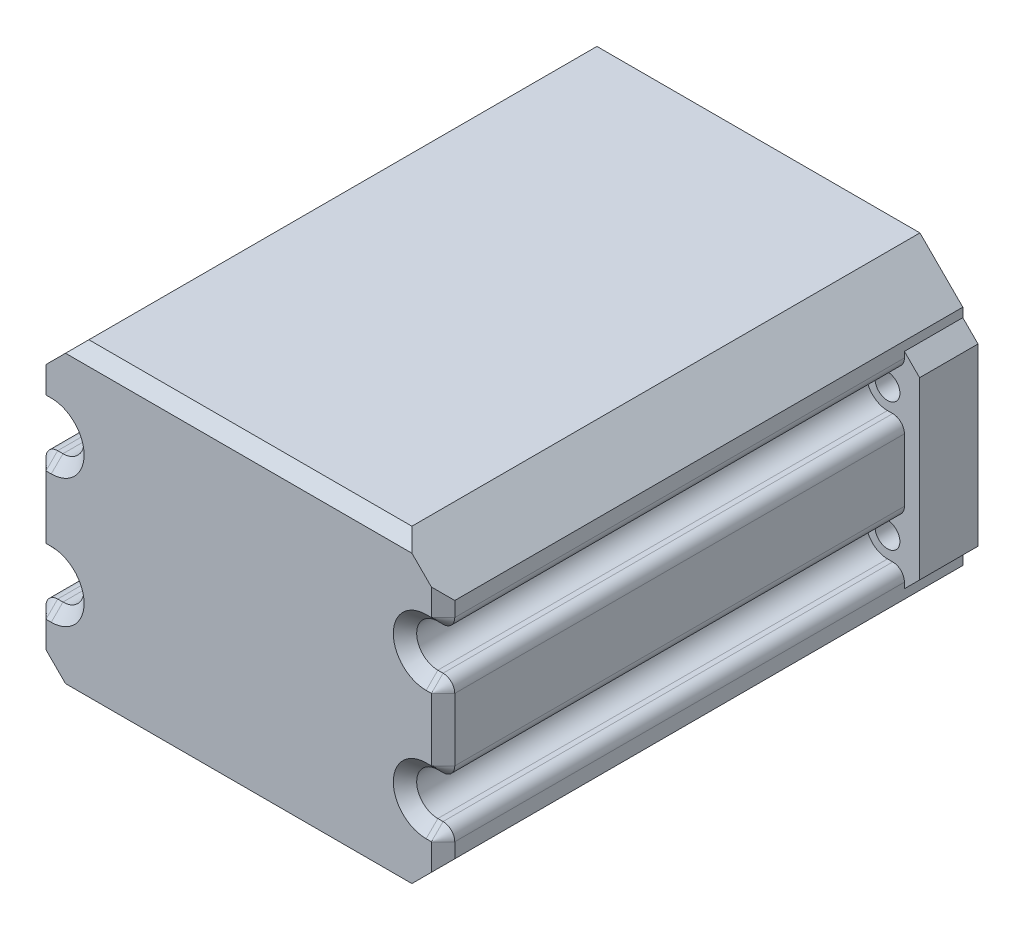
from build123d import *

# Parameters (mm, degrees)
BOSS_EXTRUDE1_DEPTH = 85
SKETCH1_3_R         = 2.125
BOSS_EXTRUDE2_DEPTH = 10
FILLET1_R           = 2
BOSS_EXTRUDE3_START = 4
BOSS_EXTRUDE3_DEPTH = 4
CHAMFER1_SIZE       = 2


with BuildPart() as part:
    # Sketch1 → Boss-Extrude1 (new body)
    with BuildSketch(Plane.XY):
        with BuildLine():
            Line((55.313708499, 53), (0, 53))
            Line((0, 53), (-7.343145751, 45.656854249))
            Line((-7.343145751, 45.656854249), (-7.343145751, 41.125))
            Line((-7.343145751, 41.125), (-4.443145751, 41.125))
            ThreePointArc((-4.443145751, 41.125), (-0.818145751, 37.5), (-4.443145751, 33.875))
            Line((-4.443145751, 33.875), (-7.343145751, 33.875))
            Line((-7.343145751, 33.875), (-7.343145751, 19.125))
            Line((-7.343145751, 19.125), (-4.443145751, 19.125))
            ThreePointArc((-4.443145751, 19.125), (-0.818145751, 15.5), (-4.443145751, 11.875))
            Line((-4.443145751, 11.875), (-7.343145751, 11.875))
            Line((-7.343145751, 11.875), (-7.343145751, 7.343145751))
            Line((-7.343145751, 7.343145751), (0, 0))
            Line((0, 0), (55.313708499, 0))
            Line((55.313708499, 0), (62.656854249, 7.343145751))
            Line((62.656854249, 7.343145751), (62.656854249, 11.875))
            Line((62.656854249, 11.875), (59.756854249, 11.875))
            ThreePointArc((59.756854249, 11.875), (56.131854249, 15.5), (59.756854249, 19.125))
            Line((59.756854249, 19.125), (62.656854249, 19.125))
            Line((62.656854249, 19.125), (62.656854249, 33.875))
            Line((62.656854249, 33.875), (59.756854249, 33.875))
            ThreePointArc((59.756854249, 33.875), (56.131854249, 37.5), (59.756854249, 41.125))
            Line((59.756854249, 41.125), (62.656854249, 41.125))
            Line((62.656854249, 41.125), (62.656854249, 45.656854249))
            Line((62.656854249, 45.656854249), (55.313708499, 53))
        make_face()
        with BuildLine():
            Line((53.656854249, 4), (1.656854249, 4))
            Line((1.656854249, 4), (-3.343145751, 9))
            Line((-3.343145751, 9), (-3.343145751, 9.601695159))
            ThreePointArc((-3.343145751, 9.601695159), (0.172046553, 11.665942097), (1.556854249, 15.5))
            Line((1.556854249, 15.5), (1.556854249, 37.5))
            ThreePointArc((1.556854249, 37.5), (0.172046553, 41.334057903), (-3.343145751, 43.398304841))
            Line((-3.343145751, 43.398304841), (-3.343145751, 44))
            Line((-3.343145751, 44), (1.656854249, 49))
            Line((1.656854249, 49), (53.656854249, 49))
            Line((53.656854249, 49), (58.656854249, 44))
            Line((58.656854249, 44), (58.656854249, 43.398304841))
            ThreePointArc((58.656854249, 43.398304841), (55.141661946, 41.334057903), (53.756854249, 37.5))
            Line((53.756854249, 37.5), (53.756854249, 15.5))
            ThreePointArc((53.756854249, 15.5), (55.141661946, 11.665942097), (58.656854249, 9.601695159))
            Line((58.656854249, 9.601695159), (58.656854249, 9))
            Line((58.656854249, 9), (53.656854249, 4))
        make_face(mode=Mode.SUBTRACT)
    extrude(amount=BOSS_EXTRUDE1_DEPTH)

    # Sketch1<3> → Boss-Extrude2 (add)
    # profile 1 of 2: a face of its own
    with BuildSketch(Plane.XY):
        with BuildLine():
            ThreePointArc((-4.443145751, 33.875), (-0.818145751, 37.5), (-4.443145751, 41.125))
            Line((-4.443145751, 41.125), (-7.343145751, 41.125))
            Line((-7.343145751, 41.125), (-7.343145751, 44.1))
            Line((-7.343145751, 44.1), (-9.943145751, 41.5))
            Line((-9.943145751, 41.5), (-9.943145751, 11.5))
            Line((-9.943145751, 11.5), (-7.343145751, 8.9))
            Line((-7.343145751, 8.9), (-7.343145751, 11.875))
            Line((-7.343145751, 11.875), (-4.443145751, 11.875))
            ThreePointArc((-4.443145751, 11.875), (-0.818145751, 15.5), (-4.443145751, 19.125))
            Line((-4.443145751, 19.125), (-7.343145751, 19.125))
            Line((-7.343145751, 19.125), (-7.343145751, 33.875))
            Line((-7.343145751, 33.875), (-4.443145751, 33.875))
        make_face()
        with Locations((-4.443145751, 15.5)):
            Circle(SKETCH1_3_R, mode=Mode.SUBTRACT)
        with Locations((-4.443145751, 37.5)):
            Circle(SKETCH1_3_R, mode=Mode.SUBTRACT)
    # profile 2 of 2: a face of its own
    with BuildSketch(Plane.XY):
        with BuildLine():
            Line((65.256854249, 41.5), (62.656854249, 44.1))
            Line((62.656854249, 44.1), (62.656854249, 41.125))
            Line((62.656854249, 41.125), (59.756854249, 41.125))
            ThreePointArc((59.756854249, 41.125), (56.131854249, 37.5), (59.756854249, 33.875))
            Line((59.756854249, 33.875), (62.656854249, 33.875))
            Line((62.656854249, 33.875), (62.656854249, 19.125))
            Line((62.656854249, 19.125), (59.756854249, 19.125))
            ThreePointArc((59.756854249, 19.125), (56.131854249, 15.5), (59.756854249, 11.875))
            Line((59.756854249, 11.875), (62.656854249, 11.875))
            Line((62.656854249, 11.875), (62.656854249, 8.9))
            Line((62.656854249, 8.9), (65.256854249, 11.5))
            Line((65.256854249, 11.5), (65.256854249, 41.5))
        make_face()
        with Locations((59.756854249, 37.5)):
            Circle(SKETCH1_3_R, mode=Mode.SUBTRACT)
        with Locations((59.756854249, 15.5)):
            Circle(SKETCH1_3_R, mode=Mode.SUBTRACT)
    extrude(amount=BOSS_EXTRUDE2_DEPTH)

    # Fillet1
    fillet1_edges = [part.edges().sort_by_distance(p)[0] for p in [
        (62.656854249, 41.125, 47.5),
        (62.656854249, 33.875, 47.5),
        (62.656854249, 19.125, 47.5),
        (62.656854249, 11.875, 47.5),
        (-7.343145751, 11.875, 47.5),
        (-7.343145751, 19.125, 47.5),
        (-7.343145751, 33.875, 47.5),
        (-7.343145751, 41.125, 47.5),
    ]]
    fillet(fillet1_edges, radius=FILLET1_R)

    # Sketch2 → Boss-Extrude3 (add)
    with BuildSketch(Plane.XY.offset(85).offset(BOSS_EXTRUDE3_START)):
        with BuildLine():
            Line((-7.343145751, 31.875), (-7.343145751, 21.125))
            ThreePointArc((-7.343145751, 21.125), (-6.757359313, 19.710786438), (-5.343145751, 19.125))
            Line((-5.343145751, 19.125), (-4.443145751, 19.125))
            ThreePointArc((-4.443145751, 19.125), (-0.818145751, 15.5), (-4.443145751, 11.875))
            Line((-4.443145751, 11.875), (-5.343145751, 11.875))
            ThreePointArc((-5.343145751, 11.875), (-6.757359313, 11.289213562), (-7.343145751, 9.875))
            Line((-7.343145751, 9.875), (-7.343145751, 7.343145751))
            Line((-7.343145751, 7.343145751), (0, 0))
            Line((0, 0), (55.313708499, 0))
            Line((55.313708499, 0), (62.656854249, 7.343145751))
            Line((62.656854249, 7.343145751), (62.656854249, 9.875))
            ThreePointArc((62.656854249, 9.875), (62.071067812, 11.289213562), (60.656854249, 11.875))
            Line((60.656854249, 11.875), (59.756854249, 11.875))
            ThreePointArc((59.756854249, 11.875), (56.131854249, 15.5), (59.756854249, 19.125))
            Line((59.756854249, 19.125), (60.656854249, 19.125))
            ThreePointArc((60.656854249, 19.125), (62.071067812, 19.710786438), (62.656854249, 21.125))
            Line((62.656854249, 21.125), (62.656854249, 31.875))
            ThreePointArc((62.656854249, 31.875), (62.071067812, 33.289213562), (60.656854249, 33.875))
            Line((60.656854249, 33.875), (59.756854249, 33.875))
            ThreePointArc((59.756854249, 33.875), (56.131854249, 37.5), (59.756854249, 41.125))
            Line((59.756854249, 41.125), (60.656854249, 41.125))
            ThreePointArc((60.656854249, 41.125), (62.071067812, 41.710786438), (62.656854249, 43.125))
            Line((62.656854249, 43.125), (62.656854249, 45.656854249))
            Line((62.656854249, 45.656854249), (55.313708499, 53))
            Line((55.313708499, 53), (0, 53))
            Line((0, 53), (-7.343145751, 45.656854249))
            Line((-7.343145751, 45.656854249), (-7.343145751, 43.125))
            ThreePointArc((-7.343145751, 43.125), (-6.757359313, 41.710786438), (-5.343145751, 41.125))
            Line((-5.343145751, 41.125), (-4.443145751, 41.125))
            ThreePointArc((-4.443145751, 41.125), (-0.818145751, 37.5), (-4.443145751, 33.875))
            Line((-4.443145751, 33.875), (-5.343145751, 33.875))
            ThreePointArc((-5.343145751, 33.875), (-6.757359313, 33.289213562), (-7.343145751, 31.875))
        make_face()
    extrude(amount=-BOSS_EXTRUDE3_DEPTH)

    # Chamfer1
    chamfer1_edges = [part.edges().sort_by_distance(p)[0] for p in [
        (-7.343145751, 44.390927125, 89),
        (-6.757359313, 41.710786438, 89),
        (-4.893145751, 41.125, 89),
        (-0.818145751, 37.5, 89),
        (-4.893145751, 33.875, 89),
        (-6.757359313, 33.289213562, 89),
        (-7.343145751, 26.5, 89),
        (-6.757359313, 19.710786438, 89),
        (-4.893145751, 19.125, 89),
        (-0.818145751, 15.5, 89),
        (-4.893145751, 11.875, 89),
        (-6.757359313, 11.289213562, 89),
        (-7.343145751, 8.609072875, 89),
        (27.656854249, 0, 89),
        (62.656854249, 8.609072875, 89),
        (62.071067812, 11.289213562, 89),
        (60.206854249, 11.875, 89),
        (56.131854249, 15.5, 89),
        (60.206854249, 19.125, 89),
        (62.071067812, 19.710786438, 89),
        (62.656854249, 26.5, 89),
        (62.071067812, 33.289213562, 89),
        (60.206854249, 33.875, 89),
        (56.131854249, 37.5, 89),
        (60.206854249, 41.125, 89),
        (62.071067812, 41.710786438, 89),
        (62.656854249, 44.390927125, 89),
        (27.656854249, 53, 89),
    ]]
    chamfer(chamfer1_edges, length=CHAMFER1_SIZE - 0.0001)  # a hair under: the kernel refuses the full size


solid = part.part
